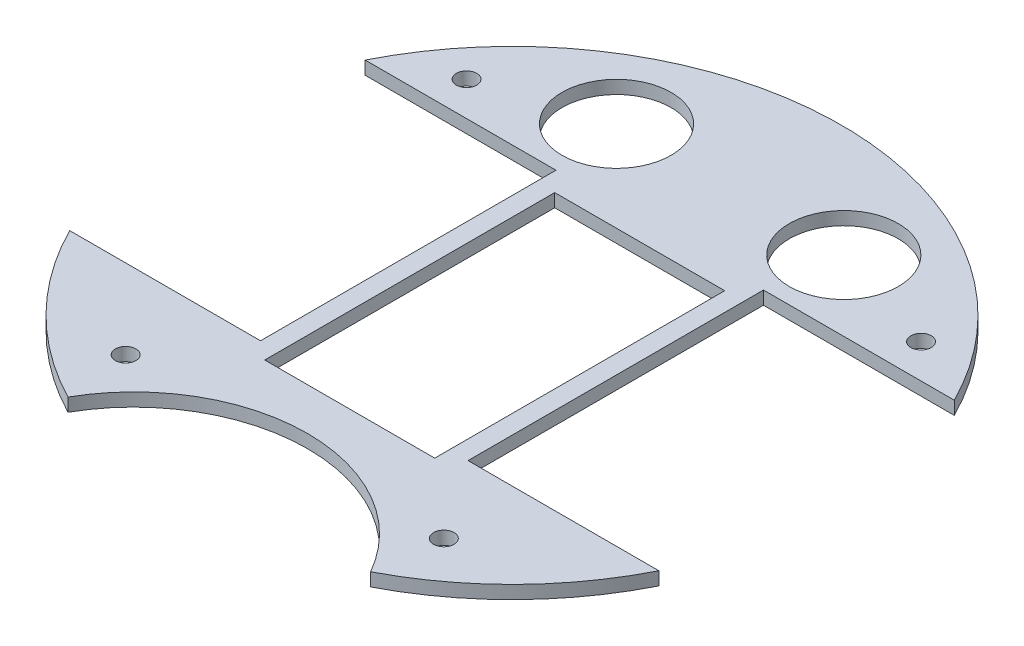
from build123d import *

# Parameters (mm, degrees)
BOSS_EXTRUDE1_DEPTH  = 2.9
SOLENOID_PLACEMENT_W = 37.4
SOLENOID_PLACEMENT_H = 63.8
CUT_EXTRUDE1_DEPTH   = 103.571487266
CUT_EXTRUDE2_DEPTH   = 103.571487266
SKETCH3_R            = 12
CUT_EXTRUDE3_DEPTH   = 98.286484159
SKETCH4_R            = 2.25
CUT_EXTRUDE4_DEPTH   = 98.416066437


with BuildPart() as part:
    # Sketch1 → Boss-Extrude1 (new body)
    with BuildSketch(Plane(origin=(0, 0, 0), x_dir=(1, 0, 0), z_dir=(0, 1, 0))):
        with BuildLine():
            ThreePointArc((33.29110537, -64.404598464), (0, 72.5), (-33.29110537, -64.404598464))
            ThreePointArc((-33.29110537, -64.404598464), (0, -44.989799638), (33.29110537, -64.404598464))
        make_face()
    extrude(amount=BOSS_EXTRUDE1_DEPTH)

    # solenoid placement → Cut-Extrude1 (cut, through all)
    with BuildSketch(Plane(origin=(0, 2.9, 0), x_dir=(1, 0, 0), z_dir=(0, 1, 0))):
        with Locations((0, -3.8)):
            Rectangle(SOLENOID_PLACEMENT_W, SOLENOID_PLACEMENT_H)
    extrude(amount=-CUT_EXTRUDE1_DEPTH, mode=Mode.SUBTRACT)

    # Sketch2 → Cut-Extrude2 (cut, through all)
    with BuildSketch(Plane(origin=(0, 2.9, 0), x_dir=(1, 0, 0), z_dir=(0, 1, 0))):
        with BuildLine():
            Line((-34.63, -32.5), (-22.83, -32.5))
            Line((-22.83, -32.5), (-22.83, 32.5))
            Line((-22.83, 32.5), (-64.807406984, 32.5))
            ThreePointArc((-64.807406984, 32.5), (-72.5, 0), (-64.807406984, -32.5))
            Line((-64.807406984, -32.5), (-34.63, -32.5))
        make_face()
        with BuildLine():
            Line((34.63, -32.5), (64.807406984, -32.5))
            ThreePointArc((64.807406984, -32.5), (72.5, 0), (64.807406984, 32.5))
            Line((64.807406984, 32.5), (22.83, 32.5))
            Line((22.83, 32.5), (22.83, -32.5))
            Line((22.83, -32.5), (34.63, -32.5))
        make_face()
    extrude(amount=-CUT_EXTRUDE2_DEPTH, mode=Mode.SUBTRACT)

    # Sketch3 → Cut-Extrude3 (cut, through all)
    with BuildSketch(Plane(origin=(0, 2.9, 0), x_dir=(1, 0, 0), z_dir=(0, 1, 0))):
        with Locations((25, 48)):
            Circle(SKETCH3_R)
        with Locations((-25, 48)):
            Circle(SKETCH3_R)
    extrude(amount=-CUT_EXTRUDE3_DEPTH, mode=Mode.SUBTRACT)

    # Sketch4 → Cut-Extrude4 (cut, through all)
    with BuildSketch(Plane(origin=(0, 5.8, 0), x_dir=(1, 0, 0), z_dir=(0, 1, 0))):
        with Locations((35, -50)):
            Circle(SKETCH4_R)
        with Locations((-35, -50)):
            Circle(SKETCH4_R)
        with Locations((-50, 40)):
            Circle(SKETCH4_R)
        with Locations((50, 40)):
            Circle(SKETCH4_R)
    extrude(amount=-CUT_EXTRUDE4_DEPTH, mode=Mode.SUBTRACT)


solid = part.part
